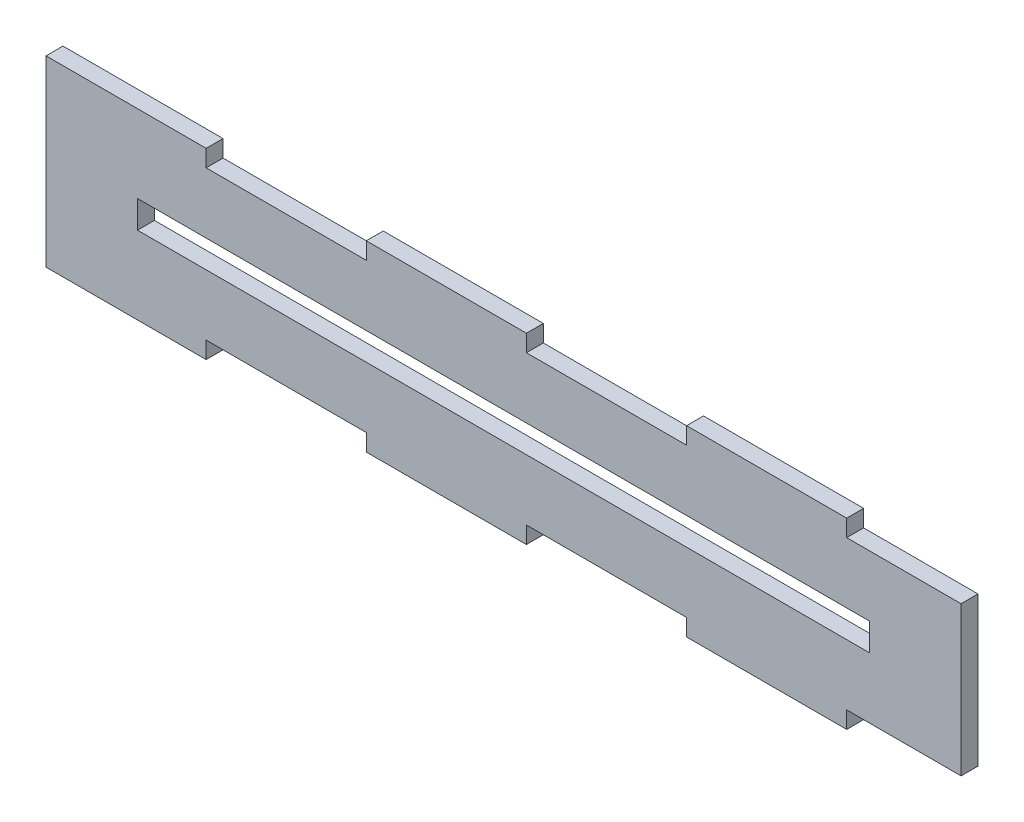
from build123d import *

# Parameters (mm, degrees)
SKETCH1_W           = 254
SKETCH1_H           = 50.8
BOSS_EXTRUDE1_DEPTH = 4.699
SKETCH2_W           = 203.2
SKETCH2_H           = 7.62
CUT_EXTRUDE1_DEPTH  = 381.549968508
CAVITY1_START       = 125.842884167
CAVITY1_OUTLINE_W   = 4.699
CAVITY1_OUTLINE_H   = 4.699
CAVITY1_DEPTH       = 44.45
CAVITY1_START_2     = 214.742884167
CAVITY1_2_OUTLINE_W = 4.699
CAVITY1_2_OUTLINE_H = 4.699
CAVITY1_2_DEPTH     = 44.45
CAVITY1_START_3     = 303.642884167
CAVITY1_3_OUTLINE_W = 4.699
CAVITY1_3_OUTLINE_H = 4.699
CAVITY1_3_DEPTH     = 31.75


# Read off the part's stored shape, not the designer's step: Cavity1
with BuildPart() as part:
    # Sketch1 → Boss-Extrude1 (new body)
    with BuildSketch(Plane.XY):
        with Locations((208.392884167, -154.343737527)):
            Rectangle(SKETCH1_W, SKETCH1_H)
    extrude(amount=BOSS_EXTRUDE1_DEPTH)

    # Sketch2 → Cut-Extrude1 (cut, through all)
    with BuildSketch(Plane(origin=(0, 0, 0), x_dir=(-1, 0, 0), z_dir=(0, 0, -1))):
        with Locations((-208.392884167, -154.343737527)):
            Rectangle(SKETCH2_W, SKETCH2_H)
    extrude(amount=-CUT_EXTRUDE1_DEPTH, mode=Mode.SUBTRACT)

    # Cavity1 outline → Cavity1 (cut)
    with BuildSketch(Plane.YZ.offset(CAVITY1_START)):
        with Locations((-177.394237527, 2.3495)):
            Rectangle(CAVITY1_OUTLINE_W, CAVITY1_OUTLINE_H)
        with Locations((-131.293237527, 2.3495)):
            Rectangle(CAVITY1_OUTLINE_W, CAVITY1_OUTLINE_H)
    extrude(amount=CAVITY1_DEPTH, mode=Mode.SUBTRACT)

    # Cavity1 2 outline → Cavity1 2 (cut)
    with BuildSketch(Plane.YZ.offset(CAVITY1_START_2)):
        with Locations((-177.394237527, 2.3495)):
            Rectangle(CAVITY1_2_OUTLINE_W, CAVITY1_2_OUTLINE_H)
        with Locations((-131.293237527, 2.3495)):
            Rectangle(CAVITY1_2_OUTLINE_W, CAVITY1_2_OUTLINE_H)
    extrude(amount=CAVITY1_2_DEPTH, mode=Mode.SUBTRACT)

    # Cavity1 3 outline → Cavity1 3 (cut)
    with BuildSketch(Plane.YZ.offset(CAVITY1_START_3)):
        with Locations((-177.394237527, 2.3495)):
            Rectangle(CAVITY1_3_OUTLINE_W, CAVITY1_3_OUTLINE_H)
        with Locations((-131.293237527, 2.3495)):
            Rectangle(CAVITY1_3_OUTLINE_W, CAVITY1_3_OUTLINE_H)
    extrude(amount=CAVITY1_3_DEPTH, mode=Mode.SUBTRACT)


solid = part.part
